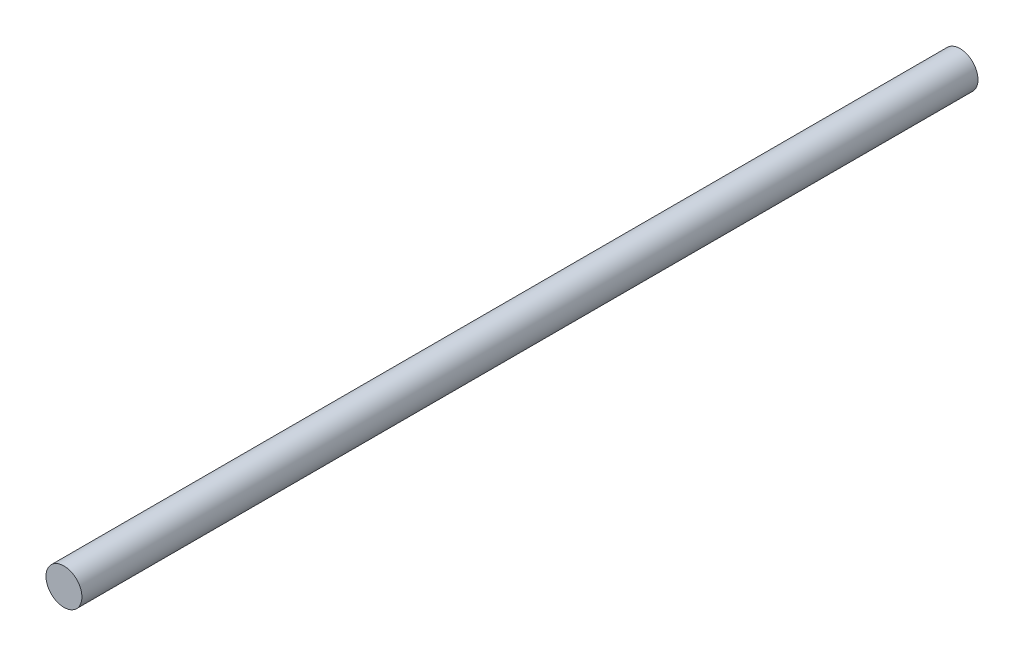
from build123d import *

# Parameters (mm, degrees)
BOSS_EXTRUDE1_START     = -316.71006
BOSS_EXTRUDE1_OUTLINE_R = 6.35
BOSS_EXTRUDE1_DEPTH     = 316.71006


# Read off the part's stored shape, not the designer's step: Boss-Extrude1
with BuildPart() as part:
    # Boss-Extrude1 outline → Boss-Extrude1 (new body)
    with BuildSketch(Plane.XY.offset(293.85006).offset(BOSS_EXTRUDE1_START)):
        Circle(BOSS_EXTRUDE1_OUTLINE_R)
    extrude(amount=BOSS_EXTRUDE1_DEPTH)


solid = part.part
